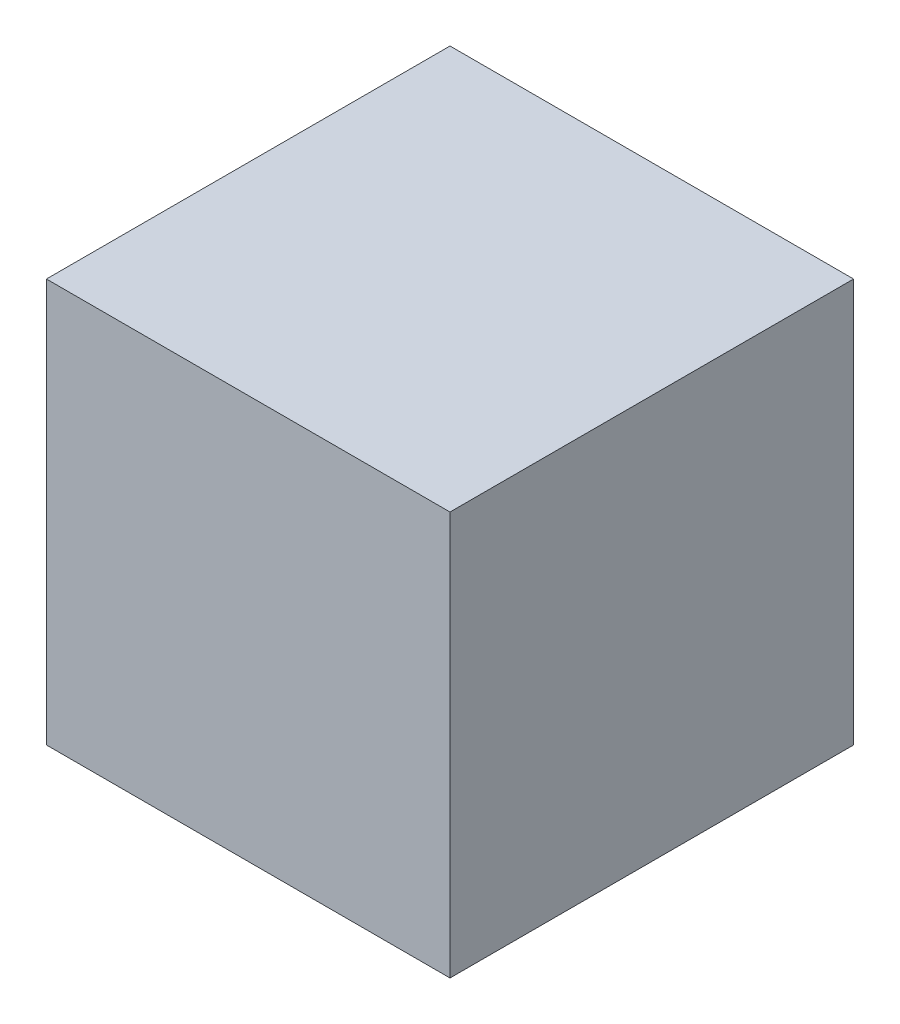
from build123d import *

# Parameters (mm, degrees)
BOSS_EXTRUDE1_DEPTH      = 32.5
BOSS_EXTRUDE1_DEPTH_BACK = 32.5
SKETCH1_W                = 65
SKETCH1_H                = 65


with BuildPart() as part:
    # Sketch1 → Boss-Extrude1 (new, two sides: drawn at the far end of the back side and taken through both)
    with BuildSketch(Plane.XY.offset(-BOSS_EXTRUDE1_DEPTH_BACK)):
        Rectangle(SKETCH1_W, SKETCH1_H)
    extrude(amount=BOSS_EXTRUDE1_DEPTH + BOSS_EXTRUDE1_DEPTH_BACK)


solid = part.part
